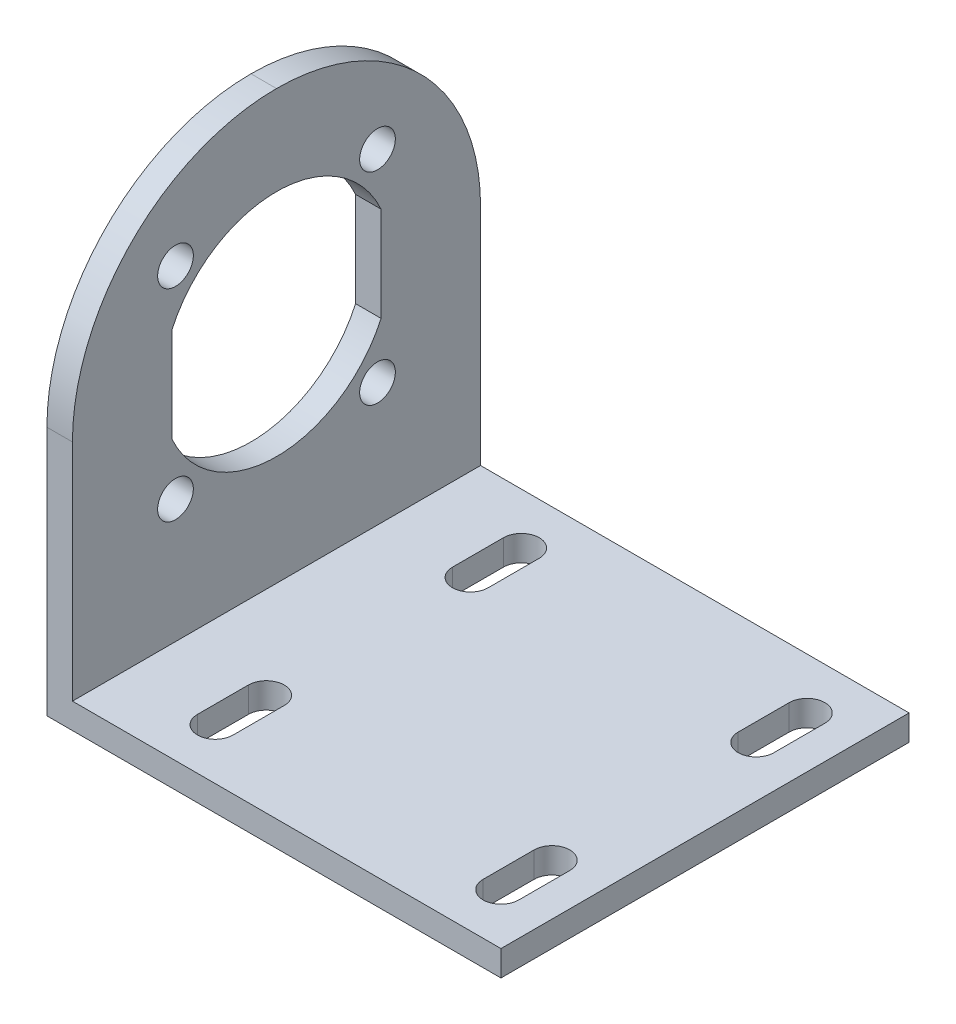
from build123d import *

# Parameters (mm, degrees)
BOSS_EXTRUDE1_DEPTH = 20
FILLET1_R           = 20
CUT_EXTRUDE1_REACH  = 66.376
SKETCH2_R           = 1.75
CUT_EXTRUDE2_REACH  = 66.376


with BuildPart() as part:
    # Sketch1 → Boss-Extrude1 (new, symmetric)
    with BuildSketch(Plane.XY):
        Polygon((0, 44.5), (0, 0), (44.5, 0), (44.5, 2.5), (2.5, 2.5), (2.5, 44.5), align=None)
    extrude(amount=BOSS_EXTRUDE1_DEPTH, both=True)

    # Fillet1
    fillet1_edges = [part.edges().sort_by_distance(p)[0] for p in [
        (1.25, 44.5, -20),
        (1.25, 44.5, 20),
    ]]
    fillet(fillet1_edges, radius=FILLET1_R - 0.0001)  # a hair under: the kernel refuses the full size

    # Sketch2 → Cut-Extrude1 (cut, up to next)
    with BuildSketch(Plane(origin=(2.5, 0, 0), x_dir=(0, 0, -1), z_dir=(1, 0, 0)), mode=Mode.PRIVATE) as cut_extrude1_sk1:
        with Locations(Location((9.899494937, 14.600505063, 0), (0, 0, 90))):
            Circle(SKETCH2_R)
    cut_extrude1_tool1 = extrude(cut_extrude1_sk1.sketch, amount=-CUT_EXTRUDE1_REACH, mode=Mode.PRIVATE) & part.part
    # Sketch2 → Cut-Extrude1 (cut, up to next)
    with BuildSketch(Plane(origin=(2.5, 0, 0), x_dir=(0, 0, -1), z_dir=(1, 0, 0)), mode=Mode.PRIVATE) as cut_extrude1_sk2:
        with Locations(Location((-9.899494937, 14.600505063, 0), (0, 0, 90))):
            Circle(SKETCH2_R)
    cut_extrude1_tool2 = extrude(cut_extrude1_sk2.sketch, amount=-CUT_EXTRUDE1_REACH, mode=Mode.PRIVATE) & part.part
    # Sketch2 → Cut-Extrude1 (cut, up to next)
    with BuildSketch(Plane(origin=(2.5, 0, 0), x_dir=(0, 0, -1), z_dir=(1, 0, 0)), mode=Mode.PRIVATE) as cut_extrude1_sk3:
        with Locations(Location((-9.899494937, 34.399494937, 0), (0, 0, 90))):
            Circle(SKETCH2_R)
    cut_extrude1_tool3 = extrude(cut_extrude1_sk3.sketch, amount=-CUT_EXTRUDE1_REACH, mode=Mode.PRIVATE) & part.part
    # Sketch2 → Cut-Extrude1 (cut, up to next)
    with BuildSketch(Plane(origin=(2.5, 0, 0), x_dir=(0, 0, -1), z_dir=(1, 0, 0)), mode=Mode.PRIVATE) as cut_extrude1_sk4:
        with Locations(Location((9.899494937, 34.399494937, 0), (0, 0, 90))):
            Circle(SKETCH2_R)
    cut_extrude1_tool4 = extrude(cut_extrude1_sk4.sketch, amount=-CUT_EXTRUDE1_REACH, mode=Mode.PRIVATE) & part.part
    # Sketch2 → Cut-Extrude1 (cut, up to next)
    with BuildSketch(Plane(origin=(2.5, 0, 0), x_dir=(0, 0, -1), z_dir=(1, 0, 0)), mode=Mode.PRIVATE) as cut_extrude1_sk5:
        with BuildLine():
            Line((10.25, 29.136809248), (10.25, 19.863190752))
            ThreePointArc((10.25, 19.863190752), (0, 13.25), (-10.25, 19.863190752))
            Line((-10.25, 19.863190752), (-10.25, 29.136809248))
            ThreePointArc((-10.25, 29.136809248), (0, 35.75), (10.25, 29.136809248))
        make_face()
    cut_extrude1_tool5 = extrude(cut_extrude1_sk5.sketch, amount=-CUT_EXTRUDE1_REACH, mode=Mode.PRIVATE) & part.part
    add(cut_extrude1_tool1.solids().sort_by_distance((2.5, 14.600505, -9.899495))[0], mode=Mode.SUBTRACT)
    add(cut_extrude1_tool2.solids().sort_by_distance((2.5, 14.600505, 9.899495))[0], mode=Mode.SUBTRACT)
    add(cut_extrude1_tool3.solids().sort_by_distance((2.5, 34.399495, 9.899495))[0], mode=Mode.SUBTRACT)
    add(cut_extrude1_tool4.solids().sort_by_distance((2.5, 34.399495, -9.899495))[0], mode=Mode.SUBTRACT)
    add(cut_extrude1_tool5.solids().sort_by_distance((2.5, 24.5, 0))[0], mode=Mode.SUBTRACT)

    # Sketch3 → Cut-Extrude2 (cut, up to next)
    with BuildSketch(Plane(origin=(0, 2.5, 0), x_dir=(1, 0, 0), z_dir=(0, 1, 0)), mode=Mode.PRIVATE) as cut_extrude2_sk1:
        with BuildLine():
            Line((13.25, -10), (13.25, -15))
            ThreePointArc((13.25, -15), (11.5, -16.75), (9.75, -15))
            Line((9.75, -15), (9.75, -10))
            ThreePointArc((9.75, -10), (11.5, -8.25), (13.25, -10))
        make_face()
    cut_extrude2_tool1 = extrude(cut_extrude2_sk1.sketch, amount=-CUT_EXTRUDE2_REACH, mode=Mode.PRIVATE) & part.part
    # Sketch3 → Cut-Extrude2 (cut, up to next)
    with BuildSketch(Plane(origin=(0, 2.5, 0), x_dir=(1, 0, 0), z_dir=(0, 1, 0)), mode=Mode.PRIVATE) as cut_extrude2_sk2:
        with BuildLine():
            Line((41.25, -10), (41.25, -15))
            ThreePointArc((41.25, -15), (39.5, -16.75), (37.75, -15))
            Line((37.75, -15), (37.75, -10))
            ThreePointArc((37.75, -10), (39.5, -8.25), (41.25, -10))
        make_face()
    cut_extrude2_tool2 = extrude(cut_extrude2_sk2.sketch, amount=-CUT_EXTRUDE2_REACH, mode=Mode.PRIVATE) & part.part
    # Sketch3 → Cut-Extrude2 (cut, up to next)
    with BuildSketch(Plane(origin=(0, 2.5, 0), x_dir=(1, 0, 0), z_dir=(0, 1, 0)), mode=Mode.PRIVATE) as cut_extrude2_sk3:
        with BuildLine():
            Line((13.25, 15), (13.25, 10))
            ThreePointArc((13.25, 10), (11.5, 8.25), (9.75, 10))
            Line((9.75, 10), (9.75, 15))
            ThreePointArc((9.75, 15), (11.5, 16.75), (13.25, 15))
        make_face()
    cut_extrude2_tool3 = extrude(cut_extrude2_sk3.sketch, amount=-CUT_EXTRUDE2_REACH, mode=Mode.PRIVATE) & part.part
    # Sketch3 → Cut-Extrude2 (cut, up to next)
    with BuildSketch(Plane(origin=(0, 2.5, 0), x_dir=(1, 0, 0), z_dir=(0, 1, 0)), mode=Mode.PRIVATE) as cut_extrude2_sk4:
        with BuildLine():
            Line((41.25, 15), (41.25, 10))
            ThreePointArc((41.25, 10), (39.5, 8.25), (37.75, 10))
            Line((37.75, 10), (37.75, 15))
            ThreePointArc((37.75, 15), (39.5, 16.75), (41.25, 15))
        make_face()
    cut_extrude2_tool4 = extrude(cut_extrude2_sk4.sketch, amount=-CUT_EXTRUDE2_REACH, mode=Mode.PRIVATE) & part.part
    add(cut_extrude2_tool1.solids().sort_by_distance((11.5, 2.5, 12.5))[0], mode=Mode.SUBTRACT)
    add(cut_extrude2_tool2.solids().sort_by_distance((39.5, 2.5, 12.5))[0], mode=Mode.SUBTRACT)
    add(cut_extrude2_tool3.solids().sort_by_distance((11.5, 2.5, -12.5))[0], mode=Mode.SUBTRACT)
    add(cut_extrude2_tool4.solids().sort_by_distance((39.5, 2.5, -12.5))[0], mode=Mode.SUBTRACT)


solid = part.part
